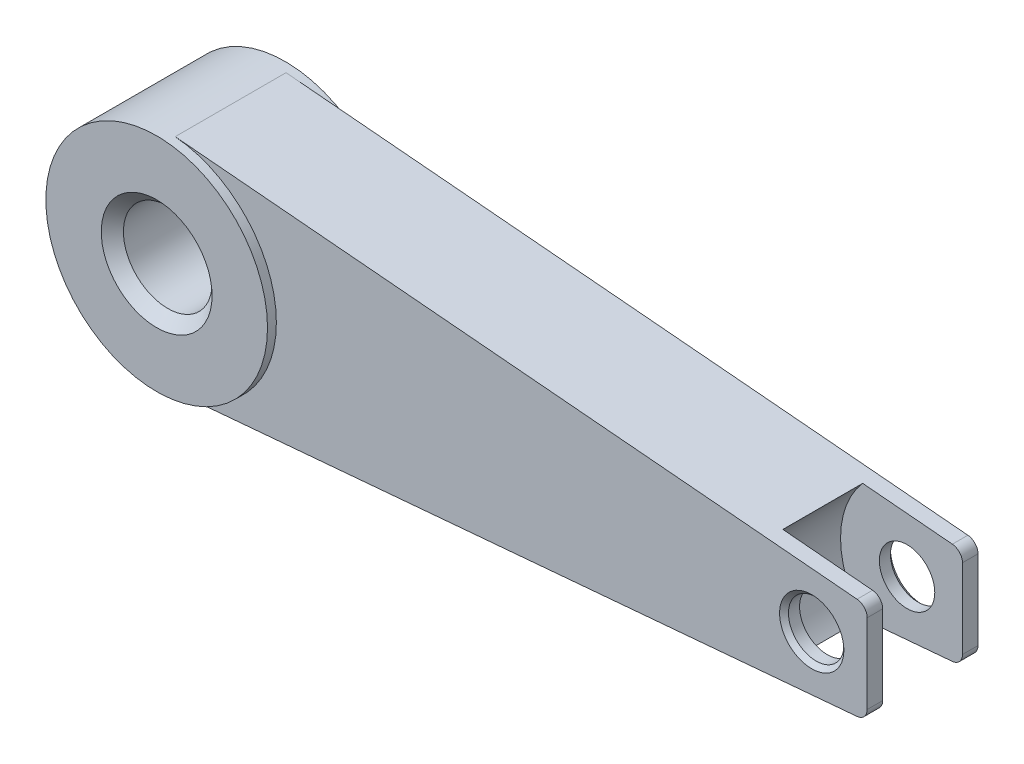
from build123d import *

# Parameters (mm, degrees)
IZIM1_R                          = 5
Y_KSEKLIK_EKSTR_ZYON1_DEPTH      = 5.8
Y_KSEKLIK_EKSTR_ZYON2_DEPTH      = 2.5
Y_KSEKLIK_EKSTR_ZYON2_DEPTH_BACK = 2.5
IZIM3_R                          = 2
KES_EKSTR_ZYON1_DEPTH            = 12.5
PAH1_SIZE                        = 0.5
KES_EKSTR_ZYON2_DEPTH            = 1.8
KES_EKSTR_ZYON2_DEPTH_BACK       = 1.8
IZIM4_R                          = 4
IZIM5_R                          = 1.25
KES_EKSTR_ZYON3_DEPTH            = 6.8
PAH2_SIZE                        = 0.2
RADYUS1_R                        = 0.5


with BuildPart() as part:
    # Çizim1 → Yükseklik-Ekstrüzyon1 (new body)
    with BuildSketch(Plane.XY):
        Circle(IZIM1_R)
    extrude(amount=Y_KSEKLIK_EKSTR_ZYON1_DEPTH)

    # Çizim2 → Yükseklik-Ekstrüzyon2 (add, two sides: drawn at the far end of the back side and taken through both)
    with BuildSketch(Plane.XY.offset(2.9).offset(-Y_KSEKLIK_EKSTR_ZYON2_DEPTH_BACK)):
        with BuildLine():
            Line((0.435778714, 4.98097349), (31.650948547, 2.25))
            Line((31.650948547, 2.25), (31.650948547, -2.25))
            Line((31.650948547, -2.25), (0.435778714, -4.98097349))
            ThreePointArc((0.435778714, -4.98097349), (-5, 0), (0.435778714, 4.98097349))
        make_face()
    extrude(amount=Y_KSEKLIK_EKSTR_ZYON2_DEPTH + Y_KSEKLIK_EKSTR_ZYON2_DEPTH_BACK)

    # Çizim3 → Kes-Ekstrüzyon1 (cut)
    with BuildSketch(Plane.XY.offset(5.8)):
        Circle(IZIM3_R)
    extrude(amount=-KES_EKSTR_ZYON1_DEPTH, mode=Mode.SUBTRACT)

    # Pah1
    pah1_edges = [part.edges().sort_by_distance(p)[0] for p in [
        (-2, 0, 0),
        (-2, 0, 5.8),
    ]]
    chamfer(pah1_edges, length=PAH1_SIZE)

    # Çizim4 → Kes-Ekstrüzyon2 (cut, two sides: drawn at the far end of the back side and taken through both)
    with BuildSketch(Plane.XY.offset(2.9).offset(-KES_EKSTR_ZYON2_DEPTH_BACK)):
        with Locations((30.150948547, 0)):
            Circle(IZIM4_R)
    extrude(amount=KES_EKSTR_ZYON2_DEPTH + KES_EKSTR_ZYON2_DEPTH_BACK, mode=Mode.SUBTRACT)

    # Çizim5 → Kes-Ekstrüzyon3 (cut)
    with BuildSketch(Plane.XY.offset(5.4)):
        with Locations((29.150948547, 0)):
            Circle(IZIM5_R)
    extrude(amount=-KES_EKSTR_ZYON3_DEPTH, mode=Mode.SUBTRACT)

    # Pah2
    pah2_edges = [part.edges().sort_by_distance(p)[0] for p in [
        (27.900948547, 0, 0.4),
        (27.900948547, 0, 5.4),
    ]]
    chamfer(pah2_edges, length=PAH2_SIZE)

    # Radyus1
    radyus1_edges = [part.edges().sort_by_distance(p)[0] for p in [
        (31.650948547, -2.25, 5.05),
        (31.650948547, 2.25, 5.05),
        (31.650948547, -2.25, 0.75),
        (31.650948547, 2.25, 0.75),
    ]]
    fillet(radyus1_edges, radius=RADYUS1_R)


solid = part.part
